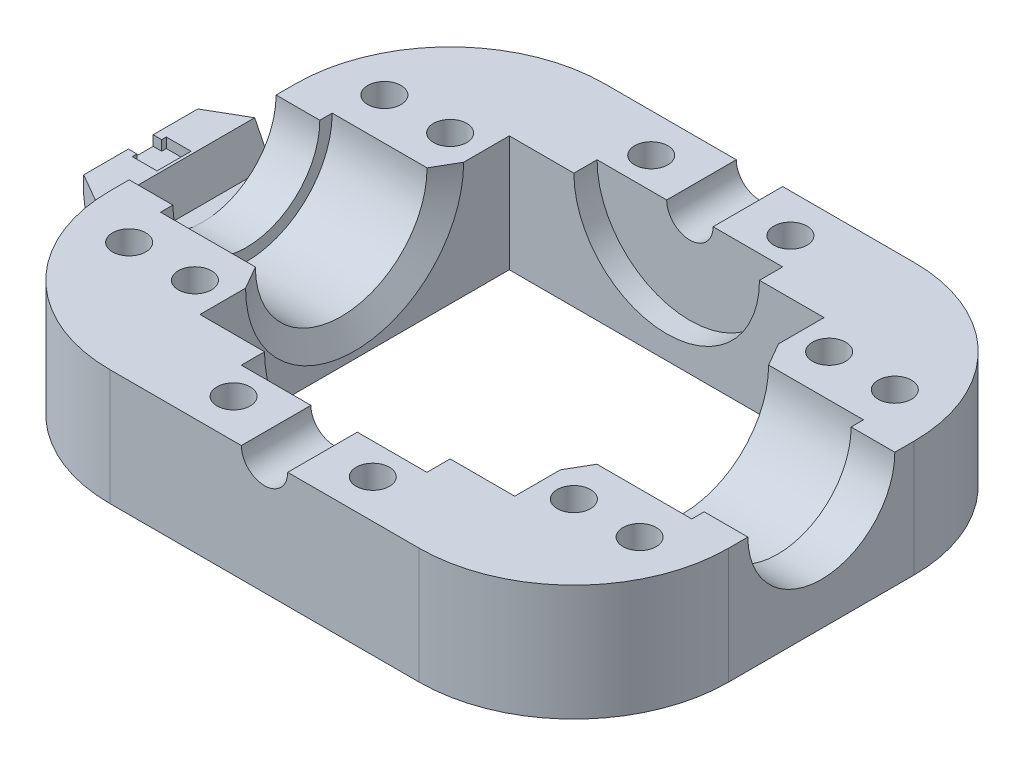
from build123d import *
from OCP.BRepFilletAPI import BRepFilletAPI_MakeChamfer

# Parameters (mm, degrees)
SKETCH1_W           = 80
SKETCH1_H           = 64
SKETCH1_W_2         = 40.7
SKETCH1_H_2         = 40
BOSS_EXTRUDE1_DEPTH = 15
SKETCH3_W           = 14
SKETCH3_H           = 11.1
SKETCH4_R           = 9.5
CUT_EXTRUDE2_DEPTH  = 88.458561616
SKETCH5_R           = 3
CUT_EXTRUDE3_DEPTH  = 77.948034413
SKETCH8_R           = 2.15
CUT_EXTRUDE6_DEPTH  = 54.37602458
FILLET1_R           = 20
CHAMFER1_SIZE       = 3
CHAMFER1_SIZE2      = 1.732050808
SKETCH9_W           = 12
SKETCH9_H           = 3
SKETCH10_W          = 24
SKETCH10_H          = 5.5
BOSS_EXTRUDE2_DEPTH = 8
BOSS_EXTRUDE3_START = 2
SKETCH12_W          = 24
SKETCH12_H          = 3.7
BOSS_EXTRUDE3_DEPTH = 6
BOSS_EXTRUDE4_DEPTH = 1.3
CHAMFER2_SIZE2      = 1.339745962
CHAMFER2_SIZE       = 5
CHAMFER3_SIZE       = 8
CHAMFER3_SIZE_2     = 4.618802154
CHAMFER4_SIZE       = 3
CHAMFER4_SIZE2      = 8.242432258


with BuildPart() as part:
    # Sketch1 → Boss-Extrude1 (new body)
    with BuildSketch(Plane(origin=(0, 0, 0), x_dir=(1, 0, 0), z_dir=(0, 1, 0))):
        Rectangle(SKETCH1_W, SKETCH1_H)
        Rectangle(SKETCH1_W_2, SKETCH1_H_2, mode=Mode.SUBTRACT)
    extrude(amount=BOSS_EXTRUDE1_DEPTH)

    # Sketch3 → Cut-Revolve1 (revolve, cut)
    with BuildSketch(Plane(origin=(0, 15, 0), x_dir=(1, 0, 0), z_dir=(0, 1, 0))):
        with Locations((27.35, -5.55)):
            Rectangle(SKETCH3_W, SKETCH3_H)
        with Locations((-27.35, -5.55)):
            Rectangle(SKETCH3_W, SKETCH3_H)
    revolve(axis=Axis((20.35, 15, 0), (1, 0, 0)), mode=Mode.SUBTRACT)

    # Sketch4 → Cut-Extrude2 (cut, through all)
    with BuildSketch(Plane(origin=(40, 0, 0), x_dir=(0, 0, -1), z_dir=(1, 0, 0))):
        with Locations((0, 15)):
            Circle(SKETCH4_R)
    extrude(amount=-CUT_EXTRUDE2_DEPTH, mode=Mode.SUBTRACT)

    # Sketch5 → Cut-Extrude3 (cut, through all)
    with BuildSketch(Plane.XY.offset(32)):
        with Locations((0, 15)):
            Circle(SKETCH5_R)
    extrude(amount=-CUT_EXTRUDE3_DEPTH, mode=Mode.SUBTRACT)

    # Sketch8 → Cut-Extrude6 (cut, through all)
    with BuildSketch(Plane(origin=(0, 15, 0), x_dir=(1, 0, 0), z_dir=(0, 1, 0))):
        with Locations(Location((24.5, 16.5, 0), (0, 0, 270))):
            Circle(SKETCH8_R)
        with Locations(Location((24.5, -16.5, 0), (0, 0, 270))):
            Circle(SKETCH8_R)
        with Locations(Location((-24.5, -16.5, 0), (0, 0, 270))):
            Circle(SKETCH8_R)
        with Locations(Location((-24.5, 16.5, 0), (0, 0, 270))):
            Circle(SKETCH8_R)
        with Locations(Location((9, -27, 0), (0, 0, 270))):
            Circle(SKETCH8_R)
        with Locations(Location((-9, -27, 0), (0, 0, 270))):
            Circle(SKETCH8_R)
        with Locations(Location((-9, 27, 0), (0, 0, 270))):
            Circle(SKETCH8_R)
        with Locations(Location((9, 27, 0), (0, 0, 270))):
            Circle(SKETCH8_R)
        with Locations(Location((-33, 16.5, 0), (0, 0, 270))):
            Circle(SKETCH8_R)
        with Locations(Location((-33, -16.5, 0), (0, 0, 270))):
            Circle(SKETCH8_R)
        with Locations(Location((33, -16.5, 0), (0, 0, 270))):
            Circle(SKETCH8_R)
        with Locations(Location((33, 16.5, 0), (0, 0, 270))):
            Circle(SKETCH8_R)
    extrude(amount=-CUT_EXTRUDE6_DEPTH, mode=Mode.SUBTRACT)

    # Fillet1
    fillet1_edges = [part.edges().sort_by_distance(p)[0] for p in [
        (-40, 7.5, -32),
        (40, 7.5, -32),
        (40, 7.5, 32),
        (-40, 7.5, 32),
    ]]
    fillet(fillet1_edges, radius=FILLET1_R)

    # Chamfer1: one chamfer whose edges measure the first distance from different faces: ONE call of the kernel's chamfer builder (chamfer() names one face for all edges)
    chamfer1_edges_1 = [part.edges().sort_by_distance(p)[0] for p in [
        (20.35, 3.9, 0),
    ]]
    chamfer1_side_1 = [part.faces().sort_by_distance(p)[0] for p in [
        (20.35, 0.427200187, 0),
    ]]
    chamfer1_edges_2 = [part.edges().sort_by_distance(p)[0] for p in [
        (-20.35, 3.9, 0),
    ]]
    chamfer1_side_2 = [part.faces().sort_by_distance(p)[0] for p in [
        (-20.35, 0.427200187, 0),
    ]]
    chamfer1 = BRepFilletAPI_MakeChamfer(part.part.solid().wrapped)
    for e in chamfer1_edges_1:
        chamfer1.Add(CHAMFER1_SIZE, CHAMFER1_SIZE2, e.wrapped, chamfer1_side_1[0].wrapped)  # the first distance lies on this face
    for e in chamfer1_edges_2:
        chamfer1.Add(CHAMFER1_SIZE, CHAMFER1_SIZE2, e.wrapped, chamfer1_side_2[0].wrapped)  # the first distance lies on this face
    add(Compound.cast(chamfer1.Shape()), mode=Mode.REPLACE)

    # Sketch9 → Cut-Revolve2 (revolve, cut)
    with BuildSketch(Plane(origin=(0, 15, 0), x_dir=(1, 0, 0), z_dir=(0, 1, 0))):
        with Locations((-6, -21.5)):
            Rectangle(SKETCH9_W, SKETCH9_H)
        with Locations((-6, 21.5)):
            Rectangle(SKETCH9_W, SKETCH9_H)
    revolve(axis=Axis((0, 15, -29.871415895), (0, 0, 1)), mode=Mode.SUBTRACT)

    # Sketch10 → Boss-Extrude2 (add)
    with BuildSketch(Plane.ZY.offset(40)):
        with Locations((0, 2.75)):
            Rectangle(SKETCH10_W, SKETCH10_H)
    extrude(amount=BOSS_EXTRUDE2_DEPTH)

    # Sketch12 → Boss-Extrude3 (add)
    with BuildSketch(Plane.ZY.offset(40).offset(BOSS_EXTRUDE3_START)):
        with Locations((0, 7.35)):
            Rectangle(SKETCH12_W, SKETCH12_H)
    extrude(amount=BOSS_EXTRUDE3_DEPTH)

    # Sketch13 → Boss-Extrude4 (add)
    with BuildSketch(Plane(origin=(0, 9.2, 0), x_dir=(1, 0, 0), z_dir=(0, 1, 0))):
        Polygon((-46.9, 2.2), (-46.9, 1.6), (-48, 1.6), (-48, 12), (-42, 12), (-42, -12), (-48, -12), (-48, -1.6), (-46.9, -1.6), (-46.9, -2.2), (-43.7, -2.2), (-43.7, 2.2), align=None)
    extrude(amount=BOSS_EXTRUDE4_DEPTH)

    # Chamfer2
    chamfer2_edges = [part.edges().sort_by_distance(p)[0] for p in [
        (-42, 10.5, 0),
    ]]
    chamfer2_side = [part.faces().sort_by_distance(p)[0] for p in [
        (-42, 10.473205081, 0),
    ]]
    chamfer(chamfer2_edges, length=CHAMFER2_SIZE - 0.0001, length2=CHAMFER2_SIZE2 - 0.0001, reference=chamfer2_side[0])  # a hair under: the kernel refuses the full size

    # Chamfer3
    chamfer3_edges_1 = [part.edges().sort_by_distance(p)[0] for p in [
        (-48, 5.25, 12),
    ]]
    chamfer3_side_1 = [part.faces().sort_by_distance(p)[0] for p in [
        (-47.907623957, 5.25, 12),
    ]]
    chamfer3_edges_2 = [part.edges().sort_by_distance(p)[0] for p in [
        (-48, 5.25, -12),
    ]]
    chamfer3_side_2 = [part.faces().sort_by_distance(p)[0] for p in [
        (-47.907623957, 5.25, -12),
    ]]
    chamfer3 = BRepFilletAPI_MakeChamfer(part.part.solid().wrapped)
    for e in chamfer3_edges_1:
        chamfer3.Add(CHAMFER3_SIZE - 0.0001, CHAMFER3_SIZE_2 - 0.0001, e.wrapped, chamfer3_side_1[0].wrapped)
    for e in chamfer3_edges_2:
        chamfer3.Add(CHAMFER3_SIZE - 0.0001, CHAMFER3_SIZE_2 - 0.0001, e.wrapped, chamfer3_side_2[0].wrapped)
    add(Compound.cast(chamfer3.Shape()), mode=Mode.REPLACE)  # a hair under: the kernel refuses the full size

    # Chamfer4
    chamfer4_edges = [part.edges().sort_by_distance(p)[0] for p in [
        (-48, 0, 0),
    ]]
    chamfer4_side = [part.faces().sort_by_distance(p)[0] for p in [
        (-40.00005, 0, 10.911882359),
    ]]
    chamfer(chamfer4_edges, length=CHAMFER4_SIZE, length2=CHAMFER4_SIZE2, reference=chamfer4_side[0])


solid = part.part
